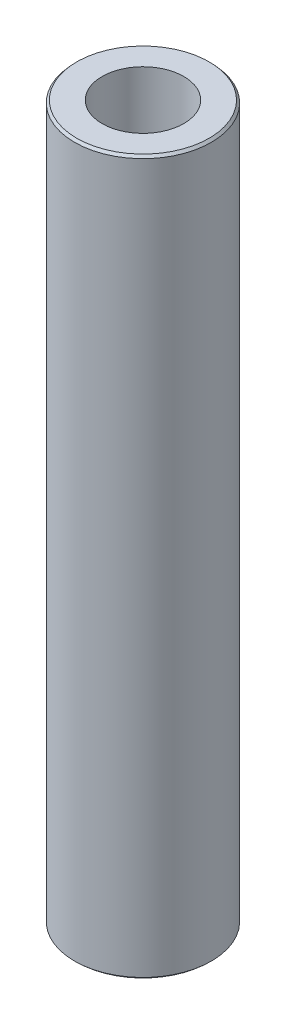
from build123d import *
from OCP.BRepFilletAPI import BRepFilletAPI_MakeChamfer

# Parameters (mm, degrees)
SKETCH1_R           = 57.5
BOSS_EXTRUDE1_DEPTH = 600
SKETCH2_R           = 34.336691799
CUT_EXTRUDE1_DEPTH  = 606.485342515
CHAMFER1_SIZE       = 2.040328153
CHAMFER1_SIZE2      = 1.845433373


with BuildPart() as part:
    # Sketch1 → Boss-Extrude1 (new body)
    with BuildSketch(Plane(origin=(0, 0, 0), x_dir=(1, 0, 0), z_dir=(0, 1, 0))):
        Circle(SKETCH1_R)
    extrude(amount=BOSS_EXTRUDE1_DEPTH)

    # Sketch2 → Cut-Extrude1 (cut, through all)
    with BuildSketch(Plane(origin=(0, 0, 0), x_dir=(1, 0, 0), z_dir=(0, 1, 0))):
        Circle(SKETCH2_R)
    extrude(amount=CUT_EXTRUDE1_DEPTH, mode=Mode.SUBTRACT)

    # Chamfer1: one chamfer whose edges measure the first distance from different faces: ONE call of the kernel's chamfer builder (chamfer() names one face for all edges)
    chamfer1_edges_1 = [part.edges().sort_by_distance(p)[0] for p in [
        (-57.5, 600, 0),
    ]]
    chamfer1_side_1 = [part.faces().sort_by_distance(p)[0] for p in [
        (-57.5, 300, 0),
    ]]
    chamfer1_edges_2 = [part.edges().sort_by_distance(p)[0] for p in [
        (-57.5, 0, 0),
    ]]
    chamfer1_side_2 = [part.faces().sort_by_distance(p)[0] for p in [
        (-55.873654403, 0, 0),
    ]]
    chamfer1 = BRepFilletAPI_MakeChamfer(part.part.solid().wrapped)
    for e in chamfer1_edges_1:
        chamfer1.Add(CHAMFER1_SIZE, CHAMFER1_SIZE2, e.wrapped, chamfer1_side_1[0].wrapped)  # the first distance lies on this face
    for e in chamfer1_edges_2:
        chamfer1.Add(CHAMFER1_SIZE, CHAMFER1_SIZE2, e.wrapped, chamfer1_side_2[0].wrapped)  # the first distance lies on this face
    add(Compound.cast(chamfer1.Shape()), mode=Mode.REPLACE)


solid = part.part
